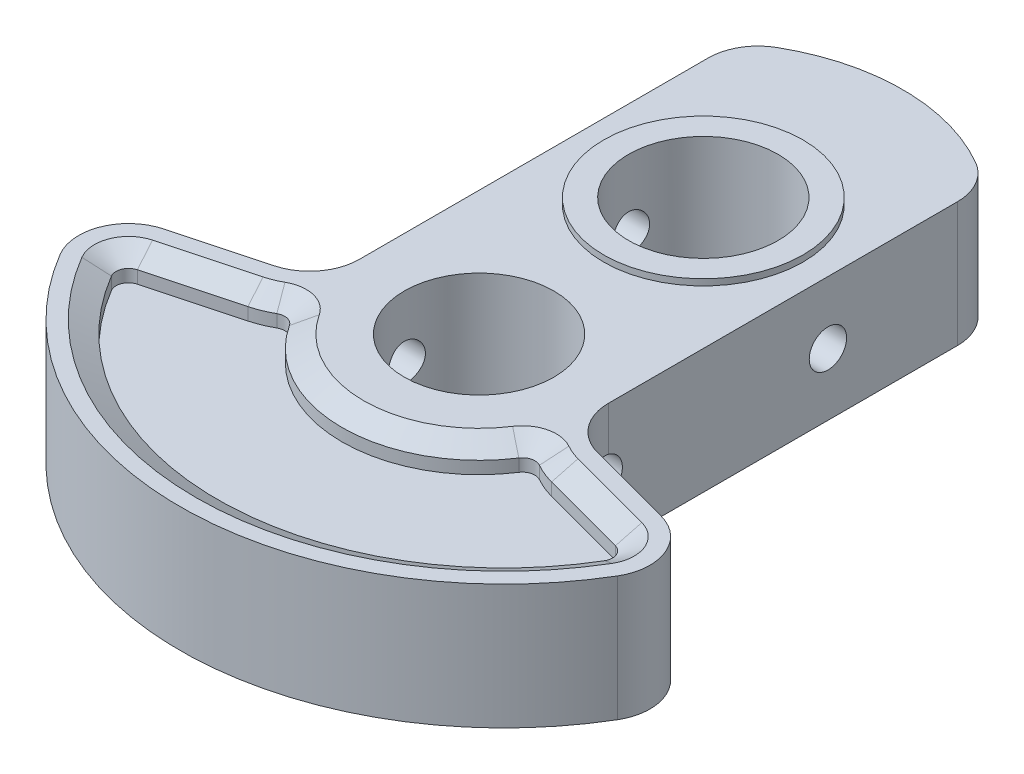
from build123d import *
from OCP.BRepFilletAPI import BRepFilletAPI_MakeChamfer

# Parameters (mm, degrees)
BOSS_EXTRUDE1_DEPTH     = 5
FILLET1_R               = 4
SKETCH3_R               = 8
BOSS_EXTRUDE2_DEPTH     = 0.5
SKETCH4_R               = 8
BOSS_EXTRUDE3_DEPTH     = 0.5
SKETCH5_R               = 6
CUT_EXTRUDE3_DEPTH      = 43.458169908
CUT_EXTRUDE4_DEPTH      = 2
CHAMFER1_SIZE           = 1
CHAMFER1_SIZE2          = 1.732050808
CHAMFER2_SIZE           = 1
CHAMFER2_SIZE2          = 1.732050808
CUT_EXTRUDE5_DEPTH      = 42.375671498
CUT_EXTRUDE5_DEPTH_BACK = 42.375671498
SKETCH7_R               = 1.5


with BuildPart() as part:
    # Sketch1 → Boss-Extrude1 (new, symmetric)
    with BuildSketch(Plane(origin=(0, 0, 0), x_dir=(1, 0, 0), z_dir=(0, 1, 0))):
        with BuildLine():
            Line((-10, 30.489995997), (-10, -2.679491924))
            Line((-10, -2.679491924), (-24.544650839, -6.576719371))
            ThreePointArc((-24.544650839, -6.576719371), (0, -24), (24.544650839, -6.576719371))
            Line((24.544650839, -6.576719371), (10, -2.679491924))
            Line((10, -2.679491924), (10, 30.489995997))
            ThreePointArc((10, 30.489995997), (0, 34), (-10, 30.489995997))
        make_face()
    extrude(amount=BOSS_EXTRUDE1_DEPTH, both=True)

    # Fillet1
    fillet1_edges = [part.edges().sort_by_distance(p)[0] for p in [
        (24.544650839, 0, 6.576719371),
        (10, 0, 2.679491924),
        (-24.544650839, 0, 6.576719371),
        (-10, 0, 2.679491924),
        (-10, 0, -30.489995997),
        (10, 0, -30.489995997),
    ]]
    fillet(fillet1_edges, radius=FILLET1_R)

    # Sketch3 → Boss-Extrude2 (add, symmetric)
    with BuildSketch(Plane.XZ.offset(5)):
        Circle(SKETCH3_R)
    extrude(amount=BOSS_EXTRUDE2_DEPTH, both=True)

    # Sketch4 → Boss-Extrude3 (add, symmetric)
    with BuildSketch(Plane(origin=(0, 5, 0), x_dir=(1, 0, 0), z_dir=(0, 1, 0))):
        with Locations((0, 18)):
            Circle(SKETCH4_R)
    extrude(amount=BOSS_EXTRUDE3_DEPTH, both=True)

    # Sketch5 → Cut-Extrude3 (cut, through all)
    with BuildSketch(Plane.XZ.offset(5.5)):
        Circle(SKETCH5_R)
        with Locations((0, -18)):
            Circle(SKETCH5_R)
    extrude(amount=-CUT_EXTRUDE3_DEPTH, mode=Mode.SUBTRACT)

    # Sketch6 → Cut-Extrude4 (cut)
    with BuildSketch(Plane(origin=(0, 5, 0), x_dir=(1, 0, 0), z_dir=(0, 1, 0))):
        with BuildLine():
            Line((12.188266684, -6.371664756), (19.186884641, -8.246938786))
            ThreePointArc((19.186884641, -8.246938786), (19.854075356, -8.835365045), (19.788432213, -9.722540276))
            ThreePointArc((19.788432213, -9.722540276), (0, -21), (-19.788432213, -9.722540276))
            ThreePointArc((-19.788432213, -9.722540276), (-19.854075356, -8.835365045), (-19.186884641, -8.246938786))
            Line((-19.186884641, -8.246938786), (-12.188266684, -6.371664756))
            ThreePointArc((-12.188266684, -6.371664756), (-11.342355786, -6.086056673), (-10.539679728, -5.695098402))
            ThreePointArc((-10.539679728, -5.695098402), (-9.810114884, -5.592432974), (-9.208235905, -6.017340901))
            ThreePointArc((-9.208235905, -6.017340901), (0, -11), (9.208235905, -6.017340901))
            ThreePointArc((9.208235905, -6.017340901), (9.810114884, -5.592432974), (10.539679728, -5.695098402))
            ThreePointArc((10.539679728, -5.695098402), (11.342355786, -6.086056673), (12.188266684, -6.371664756))
        make_face()
    cut_extrude4 = extrude(amount=-CUT_EXTRUDE4_DEPTH, mode=Mode.SUBTRACT)

    # Chamfer1: one chamfer whose edges measure the first distance from different faces: ONE call of the kernel's chamfer builder (chamfer() names one face for all edges)
    chamfer1_edges_1 = [part.edges().sort_by_distance(p)[0] for p in [
        (11.342355786, 5, 6.086056673),
    ]]
    chamfer1_side_1 = [part.faces().sort_by_distance(p)[0] for p in [
        (11.342355786, 4, 6.086056673),
    ]]
    chamfer1_edges_2 = [part.edges().sort_by_distance(p)[0] for p in [
        (9.810114884, 5, 5.592432974),
    ]]
    chamfer1_side_2 = [part.faces().sort_by_distance(p)[0] for p in [
        (9.810114884, 4, 5.592432974),
    ]]
    chamfer1_edges_3 = [part.edges().sort_by_distance(p)[0] for p in [
        (15.687575662, 5, 7.309301771),
    ]]
    chamfer1_side_3 = [part.faces().sort_by_distance(p)[0] for p in [
        (15.687575662, 4, 7.309301771),
    ]]
    chamfer1_edges_4 = [part.edges().sort_by_distance(p)[0] for p in [
        (0, 5, 11),
    ]]
    chamfer1_side_4 = [part.faces().sort_by_distance(p)[0] for p in [
        (0, 4, 11),
    ]]
    chamfer1_edges_5 = [part.edges().sort_by_distance(p)[0] for p in [
        (19.854075356, 5, 8.835365045),
    ]]
    chamfer1_side_5 = [part.faces().sort_by_distance(p)[0] for p in [
        (19.854075356, 4, 8.835365045),
    ]]
    chamfer1_edges_6 = [part.edges().sort_by_distance(p)[0] for p in [
        (-9.810114884, 5, 5.592432974),
    ]]
    chamfer1_side_6 = [part.faces().sort_by_distance(p)[0] for p in [
        (-9.810114884, 4, 5.592432974),
    ]]
    chamfer1_edges_7 = [part.edges().sort_by_distance(p)[0] for p in [
        (0, 5, 21),
    ]]
    chamfer1_side_7 = [part.faces().sort_by_distance(p)[0] for p in [
        (0, 4, 21),
    ]]
    chamfer1_edges_8 = [part.edges().sort_by_distance(p)[0] for p in [
        (-11.342355786, 5, 6.086056673),
    ]]
    chamfer1_side_8 = [part.faces().sort_by_distance(p)[0] for p in [
        (-11.342355786, 4, 6.086056673),
    ]]
    chamfer1_edges_9 = [part.edges().sort_by_distance(p)[0] for p in [
        (-19.854075356, 5, 8.835365045),
    ]]
    chamfer1_side_9 = [part.faces().sort_by_distance(p)[0] for p in [
        (-19.854075356, 4, 8.835365045),
    ]]
    chamfer1_edges_10 = [part.edges().sort_by_distance(p)[0] for p in [
        (-15.687575662, 5, 7.309301771),
    ]]
    chamfer1_side_10 = [part.faces().sort_by_distance(p)[0] for p in [
        (-15.687575662, 4, 7.309301771),
    ]]
    chamfer1 = BRepFilletAPI_MakeChamfer(part.part.solid().wrapped)
    for e in chamfer1_edges_1:
        chamfer1.Add(CHAMFER1_SIZE, CHAMFER1_SIZE2, e.wrapped, chamfer1_side_1[0].wrapped)  # the first distance lies on this face
    for e in chamfer1_edges_2:
        chamfer1.Add(CHAMFER1_SIZE, CHAMFER1_SIZE2, e.wrapped, chamfer1_side_2[0].wrapped)  # the first distance lies on this face
    for e in chamfer1_edges_3:
        chamfer1.Add(CHAMFER1_SIZE, CHAMFER1_SIZE2, e.wrapped, chamfer1_side_3[0].wrapped)  # the first distance lies on this face
    for e in chamfer1_edges_4:
        chamfer1.Add(CHAMFER1_SIZE, CHAMFER1_SIZE2, e.wrapped, chamfer1_side_4[0].wrapped)  # the first distance lies on this face
    for e in chamfer1_edges_5:
        chamfer1.Add(CHAMFER1_SIZE, CHAMFER1_SIZE2, e.wrapped, chamfer1_side_5[0].wrapped)  # the first distance lies on this face
    for e in chamfer1_edges_6:
        chamfer1.Add(CHAMFER1_SIZE, CHAMFER1_SIZE2, e.wrapped, chamfer1_side_6[0].wrapped)  # the first distance lies on this face
    for e in chamfer1_edges_7:
        chamfer1.Add(CHAMFER1_SIZE, CHAMFER1_SIZE2, e.wrapped, chamfer1_side_7[0].wrapped)  # the first distance lies on this face
    for e in chamfer1_edges_8:
        chamfer1.Add(CHAMFER1_SIZE, CHAMFER1_SIZE2, e.wrapped, chamfer1_side_8[0].wrapped)  # the first distance lies on this face
    for e in chamfer1_edges_9:
        chamfer1.Add(CHAMFER1_SIZE, CHAMFER1_SIZE2, e.wrapped, chamfer1_side_9[0].wrapped)  # the first distance lies on this face
    for e in chamfer1_edges_10:
        chamfer1.Add(CHAMFER1_SIZE, CHAMFER1_SIZE2, e.wrapped, chamfer1_side_10[0].wrapped)  # the first distance lies on this face
    add(Compound.cast(chamfer1.Shape()), mode=Mode.REPLACE)

    # Mirror5: Cut-Extrude4 across plane
    add(cut_extrude4.mirror(Plane.ZX), mode=Mode.SUBTRACT)

    # Chamfer2: one chamfer whose edges measure the first distance from different faces: ONE call of the kernel's chamfer builder (chamfer() names one face for all edges)
    chamfer2_edges_1 = [part.edges().sort_by_distance(p)[0] for p in [
        (-11.342355786, -5, 6.086056673),
    ]]
    chamfer2_side_1 = [part.faces().sort_by_distance(p)[0] for p in [
        (-11.342355786, -4, 6.086056673),
    ]]
    chamfer2_edges_2 = [part.edges().sort_by_distance(p)[0] for p in [
        (-15.687575662, -5, 7.309301771),
    ]]
    chamfer2_side_2 = [part.faces().sort_by_distance(p)[0] for p in [
        (-15.687575662, -4, 7.309301771),
    ]]
    chamfer2_edges_3 = [part.edges().sort_by_distance(p)[0] for p in [
        (-9.810114884, -5, 5.592432974),
    ]]
    chamfer2_side_3 = [part.faces().sort_by_distance(p)[0] for p in [
        (-9.810114884, -4, 5.592432974),
    ]]
    chamfer2_edges_4 = [part.edges().sort_by_distance(p)[0] for p in [
        (-19.854075356, -5, 8.835365045),
    ]]
    chamfer2_side_4 = [part.faces().sort_by_distance(p)[0] for p in [
        (-19.854075356, -4, 8.835365045),
    ]]
    chamfer2_edges_5 = [part.edges().sort_by_distance(p)[0] for p in [
        (0, -5, 11),
    ]]
    chamfer2_side_5 = [part.faces().sort_by_distance(p)[0] for p in [
        (0, -4, 11),
    ]]
    chamfer2_edges_6 = [part.edges().sort_by_distance(p)[0] for p in [
        (0, -5, 21),
    ]]
    chamfer2_side_6 = [part.faces().sort_by_distance(p)[0] for p in [
        (0, -4, 21),
    ]]
    chamfer2_edges_7 = [part.edges().sort_by_distance(p)[0] for p in [
        (9.810114884, -5, 5.592432974),
    ]]
    chamfer2_side_7 = [part.faces().sort_by_distance(p)[0] for p in [
        (9.810114884, -4, 5.592432974),
    ]]
    chamfer2_edges_8 = [part.edges().sort_by_distance(p)[0] for p in [
        (19.854075356, -5, 8.835365045),
    ]]
    chamfer2_side_8 = [part.faces().sort_by_distance(p)[0] for p in [
        (19.854075356, -4, 8.835365045),
    ]]
    chamfer2_edges_9 = [part.edges().sort_by_distance(p)[0] for p in [
        (11.342355786, -5, 6.086056673),
    ]]
    chamfer2_side_9 = [part.faces().sort_by_distance(p)[0] for p in [
        (11.342355786, -4, 6.086056673),
    ]]
    chamfer2_edges_10 = [part.edges().sort_by_distance(p)[0] for p in [
        (15.687575662, -5, 7.309301771),
    ]]
    chamfer2_side_10 = [part.faces().sort_by_distance(p)[0] for p in [
        (15.687575662, -4, 7.309301771),
    ]]
    chamfer2 = BRepFilletAPI_MakeChamfer(part.part.solid().wrapped)
    for e in chamfer2_edges_1:
        chamfer2.Add(CHAMFER2_SIZE, CHAMFER2_SIZE2, e.wrapped, chamfer2_side_1[0].wrapped)  # the first distance lies on this face
    for e in chamfer2_edges_2:
        chamfer2.Add(CHAMFER2_SIZE, CHAMFER2_SIZE2, e.wrapped, chamfer2_side_2[0].wrapped)  # the first distance lies on this face
    for e in chamfer2_edges_3:
        chamfer2.Add(CHAMFER2_SIZE, CHAMFER2_SIZE2, e.wrapped, chamfer2_side_3[0].wrapped)  # the first distance lies on this face
    for e in chamfer2_edges_4:
        chamfer2.Add(CHAMFER2_SIZE, CHAMFER2_SIZE2, e.wrapped, chamfer2_side_4[0].wrapped)  # the first distance lies on this face
    for e in chamfer2_edges_5:
        chamfer2.Add(CHAMFER2_SIZE, CHAMFER2_SIZE2, e.wrapped, chamfer2_side_5[0].wrapped)  # the first distance lies on this face
    for e in chamfer2_edges_6:
        chamfer2.Add(CHAMFER2_SIZE, CHAMFER2_SIZE2, e.wrapped, chamfer2_side_6[0].wrapped)  # the first distance lies on this face
    for e in chamfer2_edges_7:
        chamfer2.Add(CHAMFER2_SIZE, CHAMFER2_SIZE2, e.wrapped, chamfer2_side_7[0].wrapped)  # the first distance lies on this face
    for e in chamfer2_edges_8:
        chamfer2.Add(CHAMFER2_SIZE, CHAMFER2_SIZE2, e.wrapped, chamfer2_side_8[0].wrapped)  # the first distance lies on this face
    for e in chamfer2_edges_9:
        chamfer2.Add(CHAMFER2_SIZE, CHAMFER2_SIZE2, e.wrapped, chamfer2_side_9[0].wrapped)  # the first distance lies on this face
    for e in chamfer2_edges_10:
        chamfer2.Add(CHAMFER2_SIZE, CHAMFER2_SIZE2, e.wrapped, chamfer2_side_10[0].wrapped)  # the first distance lies on this face
    add(Compound.cast(chamfer2.Shape()), mode=Mode.REPLACE)

    # Sketch7 → Cut-Extrude5 (cut, two sides: drawn at the far end of the back side and taken through both)
    with BuildSketch(Plane(origin=(0, 0, 0), x_dir=(0, 0, -1), z_dir=(1, 0, 0)).offset(-CUT_EXTRUDE5_DEPTH_BACK)):
        Circle(SKETCH7_R)
        with Locations((18, 0)):
            Circle(SKETCH7_R)
    extrude(amount=CUT_EXTRUDE5_DEPTH + CUT_EXTRUDE5_DEPTH_BACK, mode=Mode.SUBTRACT)


solid = part.part
